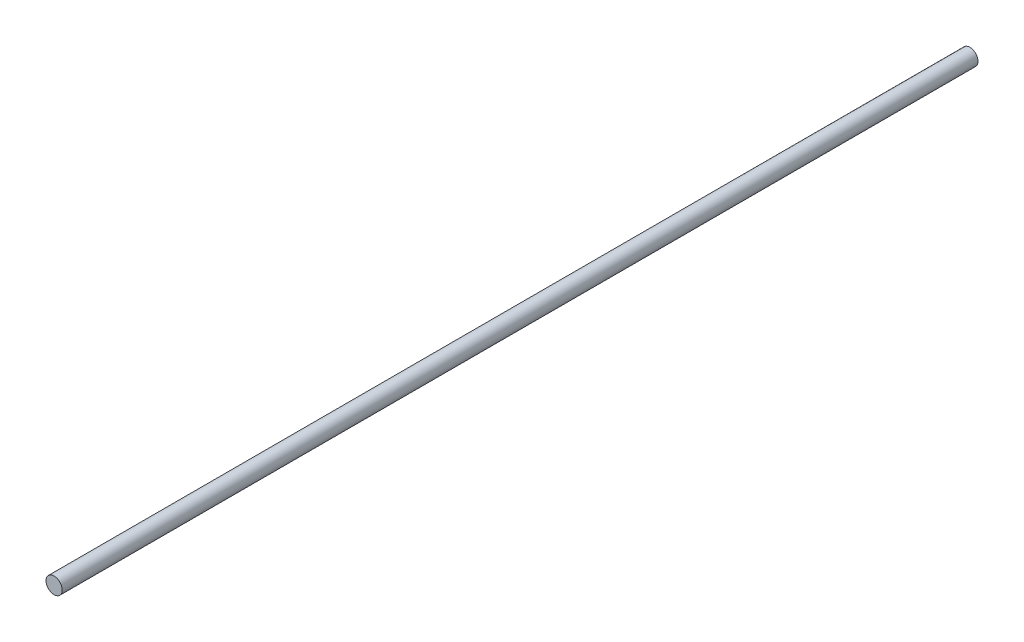
from build123d import *

# Parameters (mm, degrees)
SZKIC1_R                    = 4
DODANIE_WYCI_GNI_CIE1_DEPTH = 452


with BuildPart() as part:
    # Szkic1 → Dodanie-wyciągnięcie1 (new body)
    with BuildSketch(Plane.XY):
        Circle(SZKIC1_R)
    extrude(amount=DODANIE_WYCI_GNI_CIE1_DEPTH)


solid = part.part
